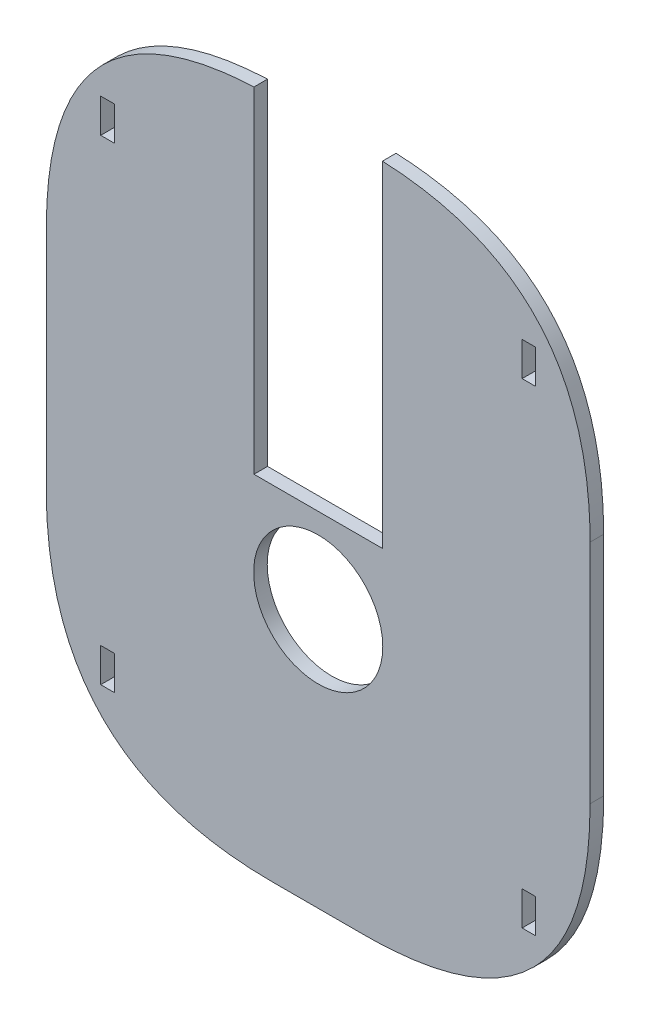
from build123d import *

# Parameters (mm, degrees)
SKETCH1_W           = 203.2
SKETCH1_H           = 254
BOSS_EXTRUDE1_DEPTH = 5.08
FILLET1_SIZE        = 84.666666667
SKETCH2_R           = 24.13
CUT_EXTRUDE1_DEPTH  = 326.318377121
SKETCH8_W           = 48.006
SKETCH8_H           = 125.503270334
CUT_EXTRUDE6_DEPTH  = 326.318377121
CUT_EXTRUDE7_DEPTH  = 326.198087964


with BuildPart() as part:
    # Sketch1 → Boss-Extrude1 (new body)
    with BuildSketch(Plane.XY):
        with Locations((101.6, 127)):
            Rectangle(SKETCH1_W, SKETCH1_H)
    extrude(amount=BOSS_EXTRUDE1_DEPTH)

    # Fillet1
    # a fillet whose section is not a circle: 84.666666667 mm, written as the material it takes off along each edge
    with BuildSketch(Plane(origin=(203.2, 254, -211.666666667), x_dir=(0, -1, 0), z_dir=(0, 0, 1)), Plane(origin=(0, 254, -211.666666667), x_dir=(1, 0, 0), z_dir=(0, 0, 1)), Plane(origin=(203.2, 0, -211.666666667), x_dir=(-1, 0, 0), z_dir=(0, 0, 1))) as fillet1_piece_1:
        with BuildLine():
            Bezier((FILLET1_SIZE, 0), (0, 0), (0, -FILLET1_SIZE), weights=[1, 1, 1])
            Line((0, -FILLET1_SIZE), (0, 0))
            Line((0, 0), (FILLET1_SIZE, 0))
        make_face()
    extrude(amount=428.413333333, mode=Mode.SUBTRACT)
    with BuildSketch(Plane(origin=(0, 0, -211.666666667), x_dir=(1, 0, 0), z_dir=(0, 0, 1))) as fillet1_piece_2:
        with BuildLine():
            Bezier((FILLET1_SIZE, 0), (0, 0), (0, FILLET1_SIZE), weights=[1, 1, 1])
            Line((0, FILLET1_SIZE), (0, 0))
            Line((0, 0), (FILLET1_SIZE, 0))
        make_face()
    extrude(amount=428.413333333, mode=Mode.SUBTRACT)

    # Sketch2 → Cut-Extrude1 (cut, through all)
    with BuildSketch(Plane.XY.offset(5.08)):
        with Locations((101.6, 96.746729666)):
            Circle(SKETCH2_R)
    extrude(amount=-CUT_EXTRUDE1_DEPTH, mode=Mode.SUBTRACT)

    # Sketch8 → Cut-Extrude6 (cut, through all)
    with BuildSketch(Plane.XY.offset(5.08)):
        with Locations((101.6, 191.248364833)):
            Rectangle(SKETCH8_W, SKETCH8_H)
    extrude(amount=-CUT_EXTRUDE6_DEPTH, mode=Mode.SUBTRACT)

    # Sketch7 → Cut-Extrude7 (cut, through all)
    with BuildSketch(Plane.XY.offset(5.08)):
        Polygon((25.4, 215.9), (25.4, 222.25), (20.32, 222.25), (20.32, 209.55), (25.4, 209.55), align=None)
        Polygon((177.8, 215.9), (177.8, 222.25), (182.88, 222.25), (182.88, 209.55), (177.8, 209.55), align=None)
        Polygon((177.8, 38.1), (177.8, 44.45), (182.88, 44.45), (182.88, 31.75), (177.8, 31.75), align=None)
        Polygon((25.4, 38.1), (25.4, 44.45), (20.32, 44.45), (20.32, 31.75), (25.4, 31.75), align=None)
    extrude(amount=-CUT_EXTRUDE7_DEPTH, mode=Mode.SUBTRACT)


solid = part.part
